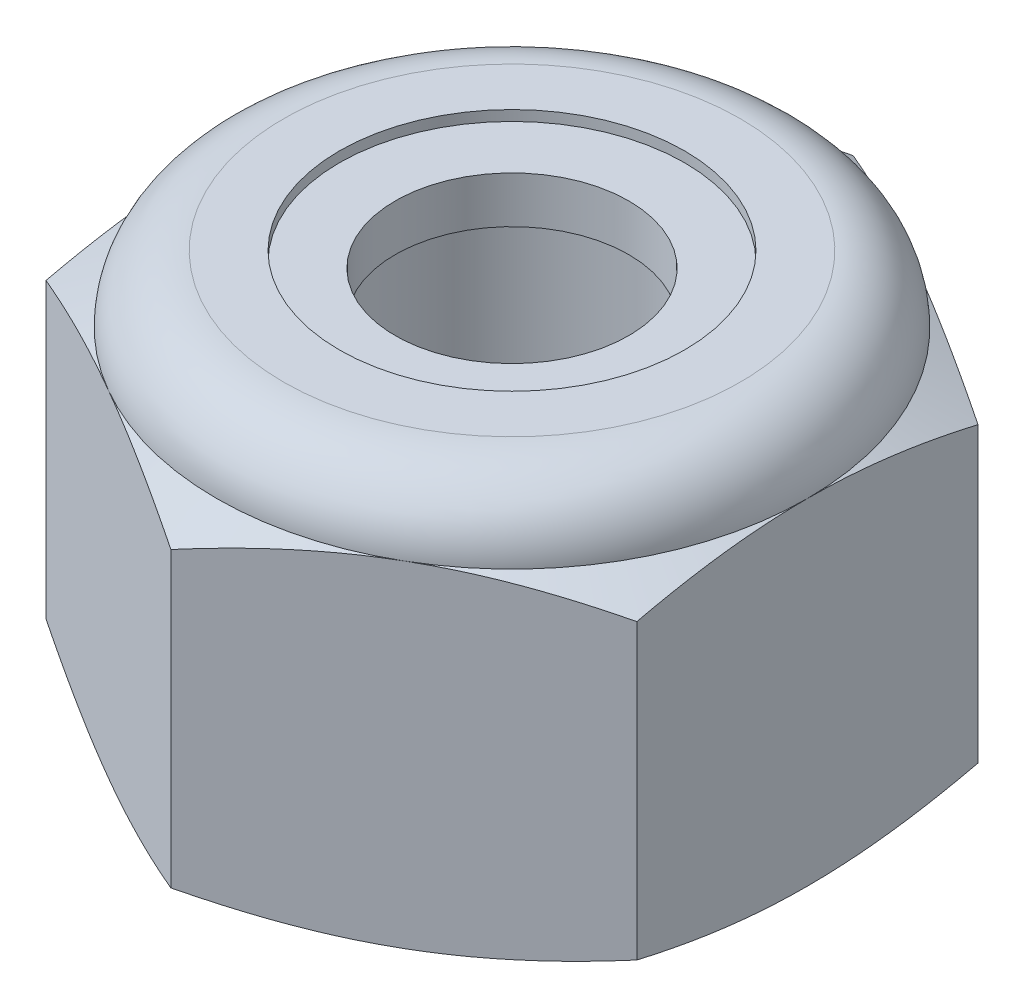
from build123d import *

# Parameters (mm, degrees)
EXTRUDE1_DEPTH = 5.953125
SKETCH2_W      = 2.0828
SKETCH2_H      = 5.953125


with BuildPart() as part:
    # Sketch1 → Extrude1 (new body)
    with BuildSketch(Plane(origin=(0, 0, 0), x_dir=(1, 0, 0), z_dir=(0, 1, 0))):
        Polygon((0, 5.040989538), (-4.365625, 2.520494769), (-4.365625, -2.520494769), (0, -5.040989538), (4.365625, -2.520494769), (4.365625, 2.520494769), align=None)
    extrude(amount=EXTRUDE1_DEPTH)


with BuildPart() as body_2:
    # Sketch2 → Revolve1 (revolve)
    with BuildSketch(Plane(origin=(0, 0, 0), x_dir=(0, 0, -1), z_dir=(1, 0, 0))):
        with Locations((1.0414, 2.9765625)):
            Rectangle(SKETCH2_W, SKETCH2_H)
    revolve(axis=Axis((0, -2.0828, 0), (0, 1, 0)))


with BuildPart() as part_1:
    add(part.part)

    # Combine1: cut body 2
    add(body_2.part, mode=Mode.SUBTRACT)

    # Sketch5 → Cut-Revolve3 (revolve, cut)
    with BuildSketch(Plane(origin=(0, 0, 0), x_dir=(0, 0, -1), z_dir=(1, 0, 0))):
        with BuildLine():
            Line((0, 0), (4.365625, 0))
            Line((4.365625, 0), (5.040989538, 0.314927656))
            Line((5.040989538, 0.314927656), (5.040989538, 4.646009844))
            Line((5.040989538, 4.646009844), (4.365625, 4.9609375))
            ThreePointArc((4.365625, 4.9609375), (4.075020009, 5.662520009), (3.3734375, 5.953125))
            Line((3.3734375, 5.953125), (3.3734375, 7.223125))
            Line((3.3734375, 7.223125), (6.310989538, 7.223125))
            Line((6.310989538, 7.223125), (6.310989538, -1.27))
            Line((6.310989538, -1.27), (0, -1.27))
            Line((0, -1.27), (0, 0))
        make_face()
    revolve(axis=Axis((0, 0, 0), (0, 1, 0)), mode=Mode.SUBTRACT)

    # Sketch6 → Cut-Revolve4 (revolve, cut)
    with BuildSketch(Plane(origin=(0, 0, 0), x_dir=(0, 0, -1), z_dir=(1, 0, 0))):
        with BuildLine():
            Line((0, 4.9609375), (4.213225, 4.9609375))
            ThreePointArc((4.213225, 4.9609375), (3.967256936, 5.554756936), (3.3734375, 5.800725))
            Line((3.3734375, 5.800725), (2.549601359, 5.800725))
            Line((2.549601359, 5.800725), (2.549601359, 7.223125))
            Line((2.549601359, 7.223125), (0, 7.223125))
            Line((0, 7.223125), (0, 4.9609375))
        make_face()
    revolve(axis=Axis((0, 7.223125, 0), (0, 1, 0)), mode=Mode.SUBTRACT)


with BuildPart() as body_2_2:
    # Sketch7 → Revolve2 (revolve)
    with BuildSketch(Plane(origin=(0, 0, 0), x_dir=(0, 0, -1), z_dir=(1, 0, 0))):
        with BuildLine():
            Line((1.725765218, 5.0371375), (4.133213408, 5.0371375))
            ThreePointArc((4.133213408, 5.0371375), (3.885726726, 5.527175629), (3.3734375, 5.724525))
            Line((3.3734375, 5.724525), (1.725765218, 5.724525))
            Line((1.725765218, 5.724525), (1.725765218, 5.0371375))
        make_face()
    revolve(axis=Axis((0, 5.0371375, 0), (0, 1, 0)))


solid = Compound([part_1.part, body_2_2.part])
